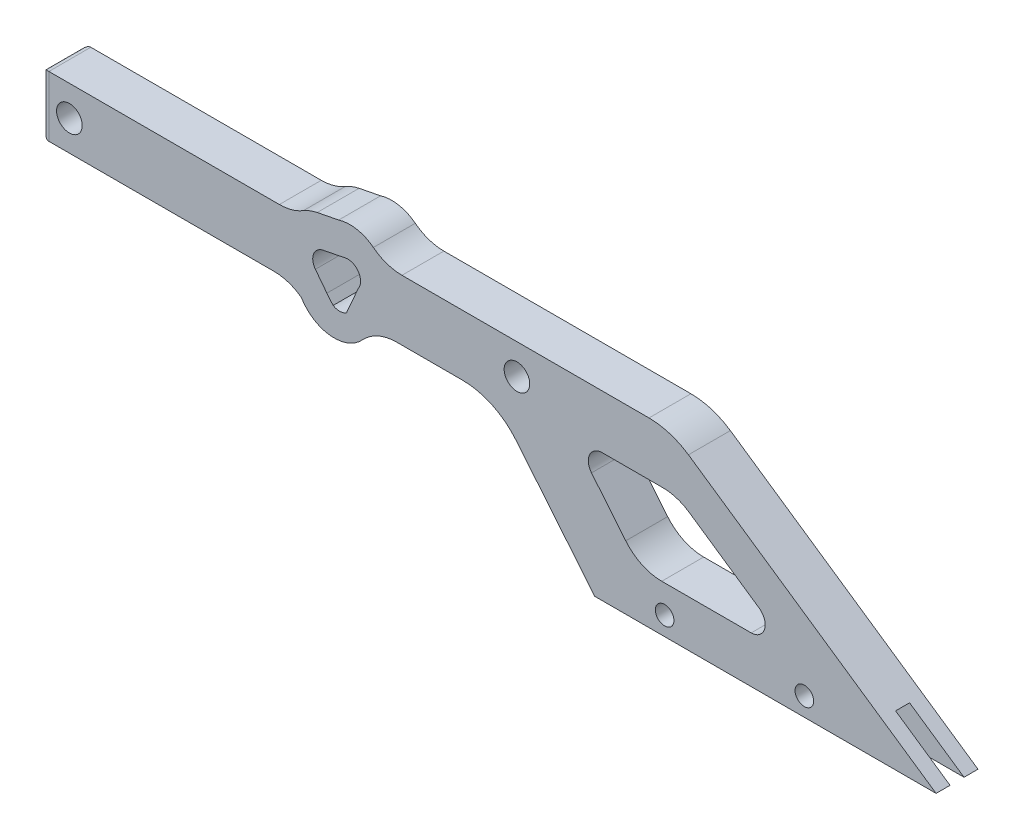
from build123d import *

# Parameters (mm, degrees)
SKETCH3_R                 = 2.75
BOSS_EXTRUDE3_DEPTH       = 4.5
FILLET13_R                = 15
FILLET14_START            = -4.5
FILLET14_DEPTH            = 9
SKETCH6_W                 = 69.28510074
SKETCH6_H                 = 3
CUT_EXTRUDE3_DEPTH        = 8
F_3_0MM_DOWEL_HOLE1_D     = 4
F_3_0MM_DOWEL_HOLE1_DEPTH = 9
F_3_0MM_DOWEL_HOLE1_TIP   = 1.201721238
CUT_EXTRUDE4_DEPTH        = 9
FILLET16_R                = 3
FILLET17_R                = 10
FILLET18_R                = 1.5


with BuildPart() as part:
    # Sketch3 → Boss-Extrude3 (new, symmetric)
    with BuildSketch(Plane.XY):
        with BuildLine():
            Line((0, 4), (-57, 43))
            Line((-57, 43), (-118.915266557, 43))
            ThreePointArc((-118.915266557, 43), (-123.007557158, 46.323583072), (-128.27688576, 46.488576653))
            Line((-128.27688576, 46.488576653), (-132.896667749, 45.573835187))
            ThreePointArc((-132.896667749, 45.573835187), (-135.482170861, 44.646108184), (-137.681223291, 43))
            Line((-137.681223291, 43), (-192, 43))
            Line((-192, 43), (-192, 30))
            Line((-192, 30), (-137.769349371, 30))
            Line((-137.769349371, 30), (-136.290115263, 28.079175362))
            ThreePointArc((-136.290115263, 28.079175362), (-129.185667244, 24.063000847), (-122.139231824, 28.180109937))
            Line((-122.139231824, 28.180109937), (-121.157209597, 30))
            Line((-121.157209597, 30), (-94.638255551, 30))
            Line((-94.638255551, 30), (-73.28510074, 4))
            Line((-73.28510074, 4), (-70, 4))
            Line((-70, 4), (0, 4))
        make_face()
        with BuildLine():
            Line((-124.060142597, 35.875632157), (-126.628090603, 30))
            ThreePointArc((-126.628090603, 30), (-128.04927418, 29.629254975), (-129.470457758, 30))
            Line((-129.470457758, 30), (-130.807389931, 31.612913936))
            Line((-130.807389931, 31.612913936), (-133.278796519, 34.822100799))
            ThreePointArc((-133.278796519, 34.822100799), (-133.674163723, 37.467564533), (-131.634144466, 39.197626677))
            Line((-131.634144466, 39.197626677), (-127.164353264, 40.082669168))
            ThreePointArc((-127.164353264, 40.082669168), (-124.113731215, 39.084848464), (-124.060142597, 35.875632157))
        make_face(mode=Mode.SUBTRACT)
        with Locations((-186.1, 36.5)):
            Circle(SKETCH3_R, mode=Mode.SUBTRACT)
        with Locations((-90, 36.5)):
            Circle(SKETCH3_R, mode=Mode.SUBTRACT)
    extrude(amount=BOSS_EXTRUDE3_DEPTH, both=True)

    # Fillet13
    fillet13_edges = [part.edges().sort_by_distance(p)[0] for p in [
        (-57, 43, 0),
        (-94.638255551, 30, 0),
    ]]
    fillet(fillet13_edges, radius=FILLET13_R)

    # Fillet14: read off the stored shape, not the designer's step
    # Fillet14 outline → Fillet14 (add)
    with BuildSketch(Plane.XY.offset(FILLET14_START)):
        with BuildLine():
            ThreePointArc((-122.139231824, 28.180109937), (-122.625925477, 27.42914609), (-123.191657584, 26.735774188))
            ThreePointArc((-123.191657584, 26.735774188), (-119.840432538, 29.147615588), (-115.800490823, 30))
            Line((-115.800490823, 30), (-121.157209597, 30))
            Line((-121.157209597, 30), (-122.139231824, 28.180109937))
        make_face()
        with BuildLine():
            ThreePointArc((-142.183070844, 30), (-139.084018861, 29.507674627), (-136.290115263, 28.079175362))
            Line((-136.290115263, 28.079175362), (-137.769349371, 30))
            Line((-137.769349371, 30), (-142.183070844, 30))
        make_face()
        with BuildLine():
            Line((-118.915266557, 43), (-114.686129887, 43))
            ThreePointArc((-114.686129887, 43), (-117.931187648, 43.541162856), (-120.825024465, 45.106079975))
            ThreePointArc((-120.825024465, 45.106079975), (-119.778687593, 44.13597249), (-118.915266557, 43))
        make_face()
        with BuildLine():
            ThreePointArc((-137.681223291, 43), (-136.817642976, 43.771248779), (-135.864478471, 44.428571429))
            ThreePointArc((-135.864478471, 44.428571429), (-138.342653588, 43.363758883), (-141.015266008, 43))
            Line((-141.015266008, 43), (-137.681223291, 43))
        make_face()
    extrude(amount=FILLET14_DEPTH)

    # Sketch6 → Cut-Extrude3 (cut)
    with BuildSketch(Plane.XZ.offset(-4)):
        with Locations((-34.64255037, 0)):
            Rectangle(SKETCH6_W, SKETCH6_H)
    extrude(amount=-CUT_EXTRUDE3_DEPTH, mode=Mode.SUBTRACT)

    # Ø3.0mm Dowel Hole1
    with Locations(Plane.XY.offset(4.5)):
        with Locations((-28.28510074, 8), (-58.28510074, 8)):
            Hole(F_3_0MM_DOWEL_HOLE1_D / 2, depth=F_3_0MM_DOWEL_HOLE1_DEPTH)
            with Locations((0, 0, -(F_3_0MM_DOWEL_HOLE1_DEPTH + F_3_0MM_DOWEL_HOLE1_TIP / 2))):  # 118° drill point
                Cone(0, F_3_0MM_DOWEL_HOLE1_D / 2, F_3_0MM_DOWEL_HOLE1_TIP, mode=Mode.SUBTRACT)

    # Sketch10 → Cut-Extrude4 (cut)
    with BuildSketch(Plane.XY.offset(4.5)):
        Polygon((-78.018937792, 31.515807302), (-55.600026057, 31.515807302), (-30, 14), (-63.633639909, 14), align=None)
    extrude(amount=-CUT_EXTRUDE4_DEPTH, mode=Mode.SUBTRACT)

    # Fillet16
    fillet16_edges = [part.edges().sort_by_distance(p)[0] for p in [
        (-78.018937792, 31.515807302, 0),
        (-30, 14, 0),
    ]]
    fillet(fillet16_edges, radius=FILLET16_R)

    # Fillet17
    fillet17_edges = [part.edges().sort_by_distance(p)[0] for p in [
        (-63.633639909, 14, 0),
        (-55.600026057, 31.515807302, 0),
    ]]
    fillet(fillet17_edges, radius=FILLET17_R)

    # Fillet18
    fillet18_edges = [part.edges().sort_by_distance(p)[0] for p in [
        (-192, 36.5, -4.5),
        (-192, 30, 0),
        (-192, 43, 0),
        (-192, 36.5, 4.5),
    ]]
    fillet(fillet18_edges, radius=FILLET18_R)


solid = part.part
